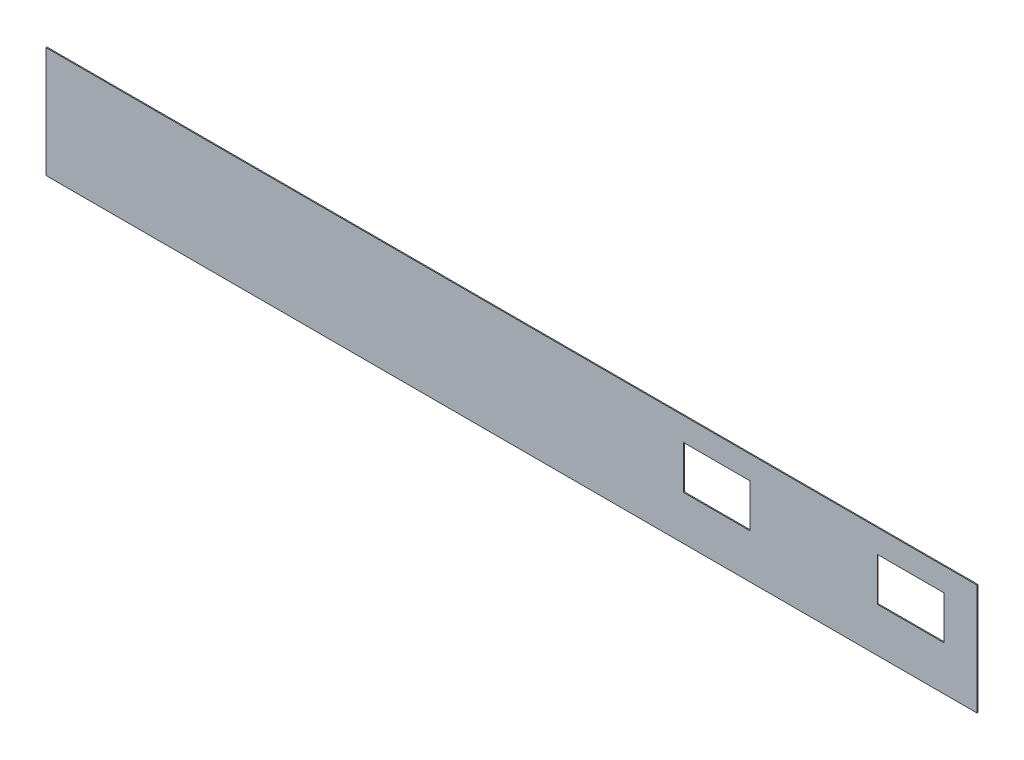
from build123d import *

# Parameters (mm, degrees)
SKETCH1_W           = 6
SKETCH1_H           = 3.9
BOSS_EXTRUDE1_DEPTH = 0.09


with BuildPart() as part:
    # Sketch1 → Boss-Extrude1 (new body)
    with BuildSketch(Plane.XY):
        Polygon((96, 0), (30, 0), (12, 0), (12, 10), (30, 10), (96, 10), align=None)
        with Locations((90, 5.95)):
            Rectangle(SKETCH1_W, SKETCH1_H, mode=Mode.SUBTRACT)
        with Locations((72.5, 5.95)):
            Rectangle(SKETCH1_W, SKETCH1_H, mode=Mode.SUBTRACT)
    extrude(amount=BOSS_EXTRUDE1_DEPTH)


solid = part.part
